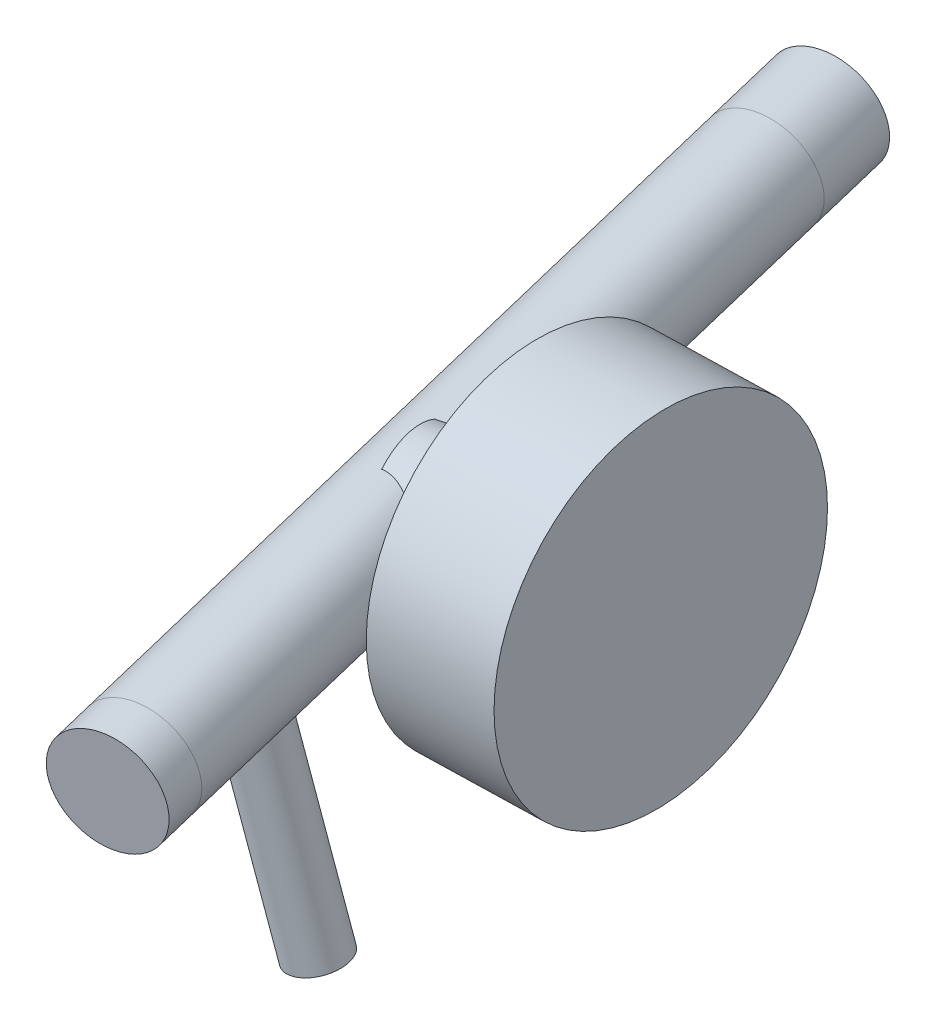
from build123d import *

# Parameters (mm, degrees)
SUSP_FR_UCA_BALL_JOINT_PROFILE_R  = 17
SUSP_FR_LCA_BALL_JOINT_PROFILE_R  = 17
SUSP_FR_UPRIGHT_KINGPIN_START     = -189.376138003
SUSP_FR_UPRIGHT_KINGPIN_OUTLINE_R = 17
SUSP_FR_UPRIGHT_KINGPIN_DEPTH     = 234.300819272
SUSP_FR_UPRIGHT_SPINDLE_PROFILE_R = 20
SUSP_FR_UPRIGHT_ARM_PROFILE_R     = 9
SUSP_FR_HUB_PROFILE_R             = 55


# Read off the part's stored shape, not the designer's step: SUSP_FR_upright_kingpin
with BuildPart() as part:
    # SUSP_FR_UCA_ball_joint: sweep along a curve in space
    with BuildLine() as susp_fr_uca_ball_joint_path:
        Line((539.215175, -109.232527, -297.644798), (534.716988, -107.000649, -323.155287))
    # SUSP_FR_UCA_ball_joint profile (on start of the path) → SUSP_FR_UCA_ball_joint (sweep)
    with BuildSketch(Plane(origin=(539.215175, -109.232527, -297.644798), x_dir=(-0.9848077563247088, 0, 0.17364815888080395), z_dir=(-0.1730071904249639, 0.0858414606043016, -0.981172643168663))):
        Circle(SUSP_FR_UCA_BALL_JOINT_PROFILE_R)
    sweep(path=susp_fr_uca_ball_joint_path.line)


with BuildPart() as body_2:
    # SUSP_FR_LCA_ball_joint: sweep along a curve in space
    with BuildLine() as susp_fr_lca_ball_joint_path:
        Line((584.249094, -131.577136, -42.2447557), (579.750906, -129.345257, -67.7552443))
    # SUSP_FR_LCA_ball_joint profile (on start of the path) → SUSP_FR_LCA_ball_joint (sweep)
    with BuildSketch(Plane(origin=(584.249094, -131.577136, -42.2447557), x_dir=(-0.9848077492574088, 0, 0.17364819896145425), z_dir=(-0.17300722977562832, 0.08584149950700166, -0.9811726328265339))):
        Circle(SUSP_FR_LCA_BALL_JOINT_PROFILE_R)
    sweep(path=susp_fr_lca_ball_joint_path.line)


with BuildPart() as susp_fr_upright_kingpin_tool:
    # SUSP_FR_upright_kingpin outline → SUSP_FR_upright_kingpin (new body)
    with BuildSketch(Plane(origin=(0, 0, 0), x_dir=(0.9849205583589563, 0.01507857135321185, -0.17234886250807685), z_dir=(0.17300720713855208, -0.08584148118504255, 0.9811726384210254)).offset(SUSP_FR_UPRIGHT_KINGPIN_START)):
        with Locations((580.73578395, -134.758317541)):
            Circle(SUSP_FR_UPRIGHT_KINGPIN_OUTLINE_R)
    extrude(amount=SUSP_FR_UPRIGHT_KINGPIN_DEPTH)


with BuildPart() as part_1:
    add(part.part)


with BuildPart() as part_2:
    # SUSP_FR_upright_kingpin: joined with susp_fr_upright_kingpin_tool
    add(part_1.part.fuse(susp_fr_upright_kingpin_tool.part, body_2.part, tol=0.00001))

    # SUSP_FR_upright_spindle: sweep along a curve in space
    with BuildLine() as susp_fr_upright_spindle_path:
        Line((563.274706, -121.170213, -161.19642), (613.584449, -120.4, -170))
    # SUSP_FR_upright_spindle profile (on start of the path) → SUSP_FR_upright_spindle (sweep)
    with BuildSketch(Plane(origin=(563.274706, -121.170213, -161.19642), x_dir=(0.17236845779024892, 0, 0.9850325450252957), z_dir=(0.9849205586549441, 0.015078562779446367, -0.17234886156670431))):
        Circle(SUSP_FR_UPRIGHT_SPINDLE_PROFILE_R)
    sweep(path=susp_fr_upright_spindle_path.line)

    # SUSP_FR_upright_arm: sweep along a curve in space
    with BuildLine() as susp_fr_upright_arm_path:
        Line((575.079712, -127.027537, -94.2469055), (590.293517, -204.990503, -103.750386))
    # SUSP_FR_upright_arm profile (on start of the path) → SUSP_FR_upright_arm (sweep)
    with BuildSketch(Plane(origin=(575.079712, -127.027537, -94.2469055), x_dir=(-0.9814869975187847, -0.1915287803479187, 0), z_dir=(0.19017256143460165, -0.9745370695403799, -0.1187935055844866))):
        Circle(SUSP_FR_UPRIGHT_ARM_PROFILE_R)
    sweep(path=susp_fr_upright_arm_path.line)

    # SUSP_FR_hub: sweep along a curve in space
    with BuildLine() as susp_fr_hub_path:
        Line((593.591303, -120.4, -169.476461), (633.577596, -120.4, -170.523539))
    # SUSP_FR_hub profile (on start of the path) → SUSP_FR_hub (sweep)
    with BuildSketch(Plane(origin=(593.591303, -120.4, -169.476461), x_dir=(0.026176949998200826, 0, 0.9996573249312944), z_dir=(0.9996573249312944, 0, -0.026176949998200826))):
        Circle(SUSP_FR_HUB_PROFILE_R)
    sweep(path=susp_fr_hub_path.line)


solid = part_2.part
